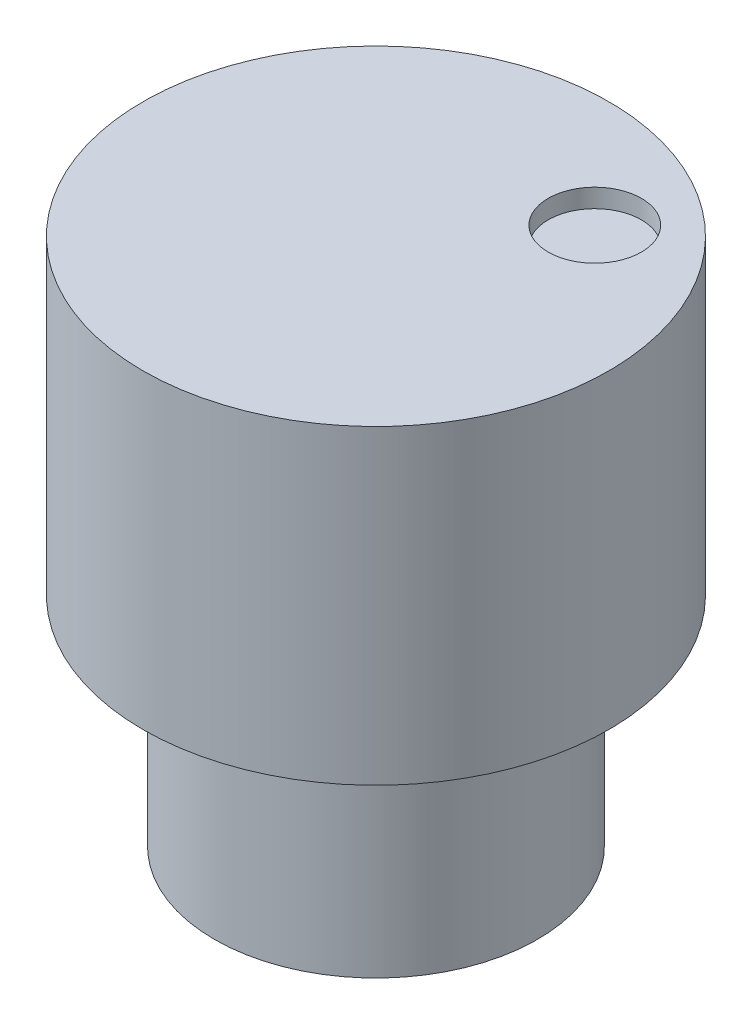
from build123d import *

# Parameters (mm, degrees)
SKETCH1_R           = 5.2
SKETCH1_R_2         = 3.2
BOSS_EXTRUDE1_DEPTH = 7
SKETCH2_R           = 7.5
BOSS_EXTRUDE2_DEPTH = 10
BOSS_EXTRUDE4_START = 5
BOSS_EXTRUDE4_DEPTH = 5
SKETCH5_R           = 1.5
CUT_EXTRUDE1_DEPTH  = 0.6


with BuildPart() as part:
    # Sketch1 → Boss-Extrude1 (new body)
    with BuildSketch(Plane(origin=(0, 0, 0), x_dir=(1, 0, 0), z_dir=(0, 1, 0))):
        Circle(SKETCH1_R)
        Circle(SKETCH1_R_2, mode=Mode.SUBTRACT)
    extrude(amount=BOSS_EXTRUDE1_DEPTH)

    # Sketch2 → Boss-Extrude2 (add)
    with BuildSketch(Plane(origin=(0, 7, 0), x_dir=(1, 0, 0), z_dir=(0, 1, 0))):
        Circle(SKETCH2_R)
    extrude(amount=BOSS_EXTRUDE2_DEPTH)

    # Sketch4 → Boss-Extrude4 (add)
    with BuildSketch(Plane.XZ.offset(-7).offset(BOSS_EXTRUDE4_START)):
        with BuildLine():
            Line((2.645751311, -1.8), (-2.645751311, -1.8))
            ThreePointArc((-2.645751311, -1.8), (0, -3.2), (2.645751311, -1.8))
        make_face()
    extrude(amount=-BOSS_EXTRUDE4_DEPTH)

    # Sketch5 → Cut-Extrude1 (cut)
    with BuildSketch(Plane(origin=(0, 17, 0), x_dir=(1, 0, 0), z_dir=(0, 1, 0))):
        with Locations((3.213938048, 3.830222216)):
            Circle(SKETCH5_R)
    extrude(amount=-CUT_EXTRUDE1_DEPTH, mode=Mode.SUBTRACT)


solid = part.part
